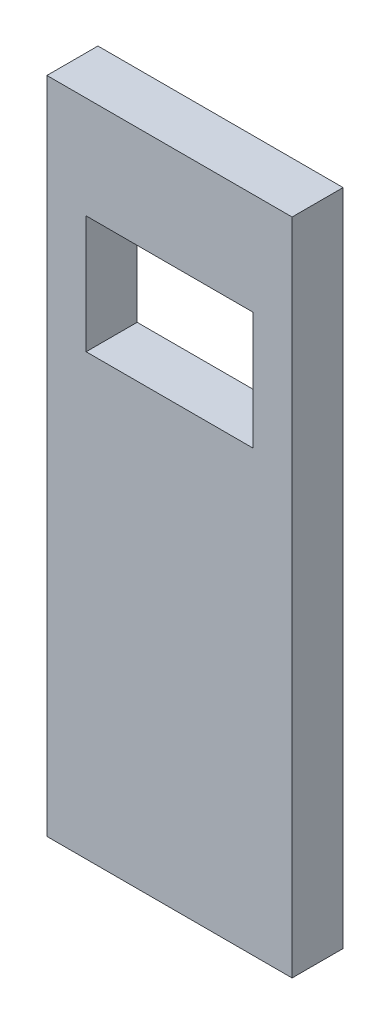
from build123d import *

# Parameters (mm, degrees)
SKETCH1_W           = 17
SKETCH1_H           = 12
BOSS_EXTRUDE1_DEPTH = 2.6


with BuildPart() as part:
    # Sketch1 → Boss-Extrude1 (new, symmetric)
    with BuildSketch(Plane.XY):
        Polygon((0, 67.2), (0, 44.8), (0, 39.6), (0, 27.6), (0, 22.4), (0, 0), (25, 0), (25, 22.4), (25, 27.6), (25, 39.6), (25, 44.8), (25, 67.2), align=None)
        with Locations((12.5, 50.8)):
            Rectangle(SKETCH1_W, SKETCH1_H, mode=Mode.SUBTRACT)
    extrude(amount=BOSS_EXTRUDE1_DEPTH, both=True)


solid = part.part
